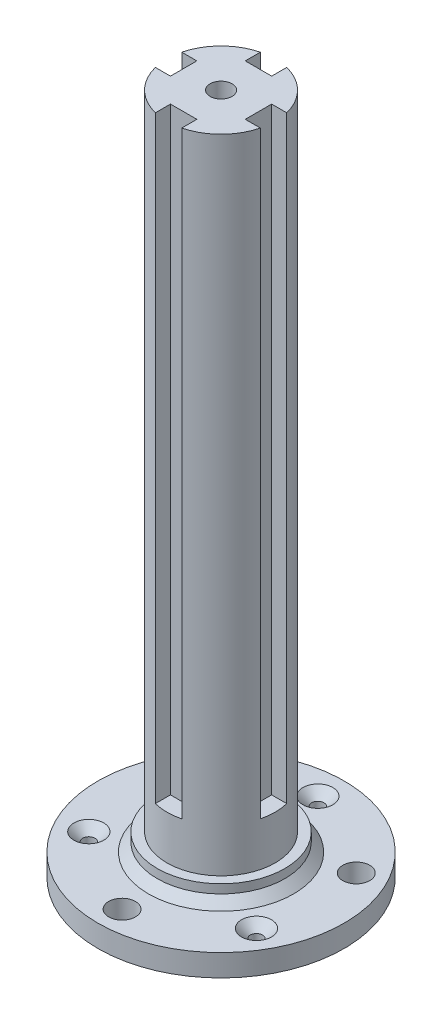
from build123d import *

# Parameters (mm, degrees)
ESBO_O1_R                = 28
RESSALTO_EXTRUS_O1_DEPTH = 5
ESBO_O6_R                = 10.75
CORTE_EXTRUS_O1_DEPTH    = 5
ESBO_O7_R                = 9
CORTE_EXTRUS_O2_DEPTH    = 0.4
CORTE_EXTRUS_O3_REACH    = 161.978
ESBO_O8_R                = 3.05
PADR_OCIRCULAR1_COUNT    = 3
CORTE_EXTRUS_O4_REACH    = 161.978
ESBO_O9_R                = 1.4
PADR_OCIRCULAR2_COUNT    = 3
PADR_OCIRCULAR3_COUNT    = 3
CHANFRO1_SIZE            = 2
CHANFRO2_SIZE            = 2
CORTE_EXTRUS_O5_DEPTH    = 136
PADR_OCIRCULAR4_COUNT    = 4
ESBO_O18_R               = 2.5
CORTE_EXTRUS_O6_DEPTH    = 10


with BuildPart() as part:
    # Esboço1 → Ressalto-extrusão1 (new body)
    with BuildSketch(Plane(origin=(0, 0, 0), x_dir=(1, 0, 0), z_dir=(0, 1, 0))):
        with Locations(Location((0, 0, 0), (0, 0, 270))):
            Circle(ESBO_O1_R)
    extrude(amount=RESSALTO_EXTRUS_O1_DEPTH)

    # Esboço5 → Revolução1 (revolve)
    with BuildSketch(Plane(origin=(0, 0, 0), x_dir=(0, 0, -1), z_dir=(1, 0, 0))):
        Polygon((0, 5), (-16.5, 5), (-14.5, 7), (-14.5, 9), (-12.3, 9), (-12.3, 155), (0, 155), align=None)
    revolve(axis=Axis((0, 155, 0), (0, -1, 0)))

    # Esboço6 → Corte-extrusão1 (cut)
    with BuildSketch(Plane.XZ):
        with Locations(Location((0, 0, 0), (0, 0, 270))):
            Circle(ESBO_O6_R)
    extrude(amount=-CORTE_EXTRUS_O1_DEPTH, mode=Mode.SUBTRACT)

    # Esboço7 → Corte-extrusão2 (cut)
    with BuildSketch(Plane.XZ.offset(-5)):
        with Locations(Location((0, 0, 0), (0, 0, 270))):
            Circle(ESBO_O7_R)
    extrude(amount=-CORTE_EXTRUS_O2_DEPTH, mode=Mode.SUBTRACT)

    # Esboço8 → Corte-extrusão3 (cut, up to next)
    with BuildSketch(Plane.XZ, mode=Mode.PRIVATE) as corte_extrus_o3_sk1:
        with Locations(Location((0, 22.5, 0), (0, 0, 270))):
            Circle(ESBO_O8_R)
    corte_extrus_o3_tool1 = extrude(corte_extrus_o3_sk1.sketch, amount=-CORTE_EXTRUS_O3_REACH, mode=Mode.PRIVATE) & part.part
    corte_extrus_o3 = corte_extrus_o3_tool1.solids().sort_by_distance((0, 0, 22.5))[0]
    add(corte_extrus_o3, mode=Mode.SUBTRACT)

    # PadrãoCircular1: Corte-extrusão3 ×3 about axis
    padr_ocircular1_axis = Axis((0, 0, 0), (0, 1, 0))
    for i in range(1, PADR_OCIRCULAR1_COUNT):
        add(corte_extrus_o3.rotate(padr_ocircular1_axis, i * 360 / PADR_OCIRCULAR1_COUNT), mode=Mode.SUBTRACT)

    # Esboço9 → Corte-extrusão4 (cut, up to next)
    with BuildSketch(Plane.XZ, mode=Mode.PRIVATE) as corte_extrus_o4_sk1:
        with Locations(Location((-19.052558883, 11, 0), (0, 0, 270))):
            Circle(ESBO_O9_R)
    corte_extrus_o4_tool1 = extrude(corte_extrus_o4_sk1.sketch, amount=-CORTE_EXTRUS_O4_REACH, mode=Mode.PRIVATE) & part.part
    corte_extrus_o4 = corte_extrus_o4_tool1.solids().sort_by_distance((-19.052559, 0, 11))[0]
    add(corte_extrus_o4, mode=Mode.SUBTRACT)

    # PadrãoCircular2: Corte-extrusão4 ×3 about axis
    padr_ocircular2_axis = Axis((0, 0, 0), (0, 1, 0))
    for i in range(1, PADR_OCIRCULAR2_COUNT):
        add(corte_extrus_o4.rotate(padr_ocircular2_axis, i * 360 / PADR_OCIRCULAR2_COUNT), mode=Mode.SUBTRACT)

    # Loft de corte1: read off the stored shape, not the designer's step
    # Loft de corte1: loft between two sections, ruled curve by curve
    loft_de_corte1_from = [
        Edge.make_bspline([(-18.260331243, 3, 17.20543513), (-17.315862444, 3, 16.040111704), (-16.150539018, 3, 16.984580503), (-17.095007817, 3, 18.149903929), (-18.039476615, 3, 19.315227355), (-19.204800042, 3, 18.370758556), (-18.260331243, 3, 17.20543513)], [0, 0, 0, 0, 0.5, 0.5, 0.5, 1, 1, 1, 1], 3, [1, 0.333333333, 0.333333333, 1, 0.333333333, 0.333333333, 1]),
    ]
    loft_de_corte1_to = [
        Edge.make_bspline([(-18.914864913, 0, 17.499210616), (-18.557947085, 0, 15.024819849), (-16.083556319, 0, 15.381737677), (-16.440474147, 0, 17.856128444), (-16.797391974, 0, 20.33051921), (-19.271782741, 0, 19.973601382), (-18.914864913, 0, 17.499210616)], [0, 0, 0, 0, 0.5, 0.5, 0.5, 1, 1, 1, 1], 3, [1, 0.333333333, 0.333333333, 1, 0.333333333, 0.333333333, 1]),
    ]
    loft_de_corte1 = Solid(Shell([*[Face.make_surface_from_curves(loft_de_corte1_from[k], loft_de_corte1_to[k]) for k in range(1)], Face(Wire(loft_de_corte1_from)), Face(Wire(loft_de_corte1_to))]))
    add(loft_de_corte1, mode=Mode.SUBTRACT)

    # PadrãoCircular3: Loft de corte1 ×3 about axis
    padr_ocircular3_axis = Axis((0, 0, 0), (0, 1, 0))
    for i in range(1, PADR_OCIRCULAR3_COUNT):
        add(loft_de_corte1.rotate(padr_ocircular3_axis, i * 360 / PADR_OCIRCULAR3_COUNT), mode=Mode.SUBTRACT)

    # Chanfro1
    chanfro1_edges = [part.edges().sort_by_distance(p)[0] for p in [
        (-19.052558883, 5, 12.4),
    ]]
    chamfer(chanfro1_edges, length=CHANFRO1_SIZE)

    # Chanfro2
    chanfro2_edges = [part.edges().sort_by_distance(p)[0] for p in [
        (20.264994449, 5, 10.3),
        (-1.212435565, 5, -22.7),
    ]]
    chamfer(chanfro2_edges, length=CHANFRO2_SIZE)

    # Esboço17 → Corte-extrusão5 (cut)
    with BuildSketch(Plane(origin=(0, 155, 0), x_dir=(1, 0, 0), z_dir=(0, 1, 0))):
        with BuildLine():
            Line((-3, 8.5), (3, 8.5))
            Line((3, 8.5), (3, 11.928537211))
            ThreePointArc((3, 11.928537211), (0, 12.3), (-3, 11.928537211))
            Line((-3, 11.928537211), (-3, 8.5))
        make_face()
    corte_extrus_o5 = extrude(amount=-CORTE_EXTRUS_O5_DEPTH, mode=Mode.SUBTRACT)

    # PadrãoCircular4: Corte-extrusão5 ×4 about axis
    padr_ocircular4_axis = Axis((0, 0, 0), (0, 1, 0))
    for i in range(1, PADR_OCIRCULAR4_COUNT):
        add(corte_extrus_o5.rotate(padr_ocircular4_axis, i * 360 / PADR_OCIRCULAR4_COUNT), mode=Mode.SUBTRACT)

    # Esboço18 → Corte-extrusão6 (cut)
    with BuildSketch(Plane(origin=(0, 155, 0), x_dir=(1, 0, 0), z_dir=(0, 1, 0))):
        with Locations(Location((0, 0, 0), (0, 0, 270))):
            Circle(ESBO_O18_R)
    extrude(amount=-CORTE_EXTRUS_O6_DEPTH, mode=Mode.SUBTRACT)


solid = part.part
